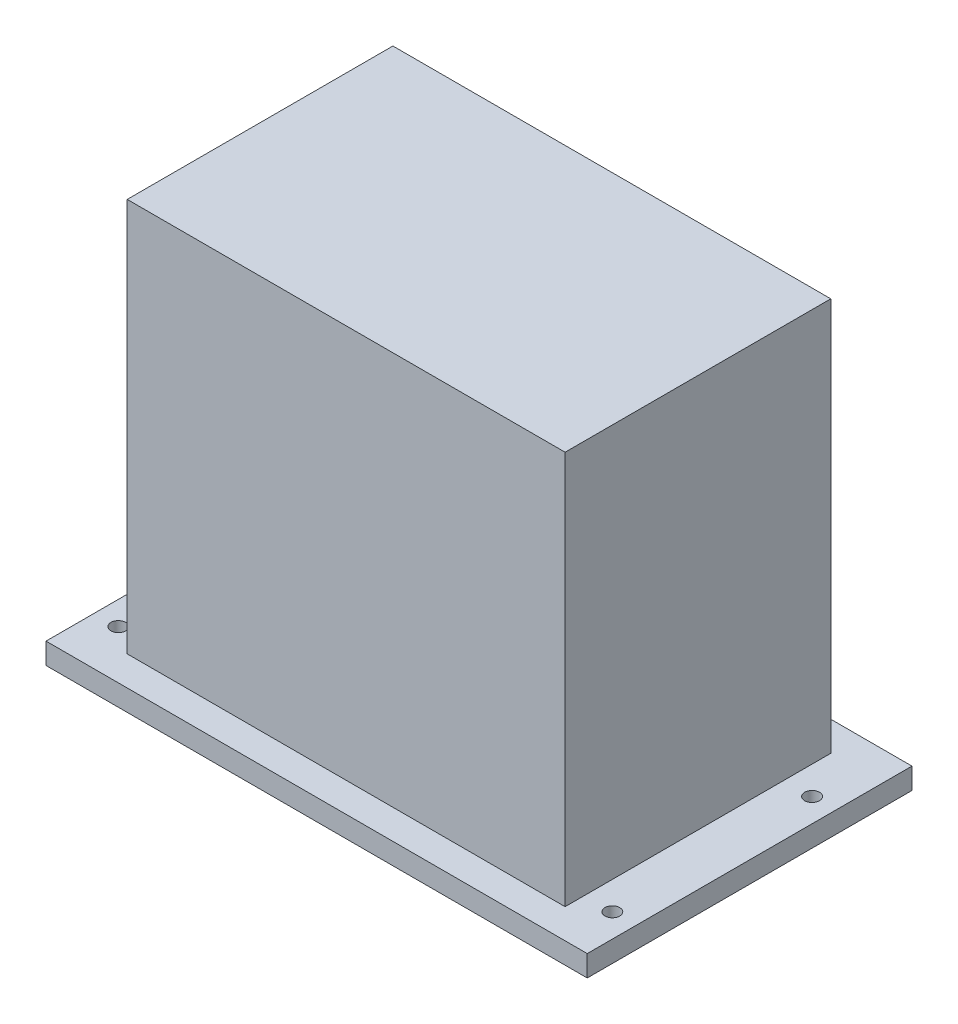
from build123d import *

# Parameters (mm, degrees)
SKETCH1_R           = 1.5
BOSS_EXTRUDE1_DEPTH = 4.3
SKETCH2_W           = 89
SKETCH2_H           = 54
BOSS_EXTRUDE2_DEPTH = 80


with BuildPart() as part:
    # Sketch1 → Boss-Extrude1 (new body)
    with BuildSketch(Plane(origin=(0, 0, 0), x_dir=(1, 0, 0), z_dir=(0, 1, 0))):
        Polygon((-35.5, 27), (-35.5, 33), (-55, 33), (-55, -33), (55, -33), (55, 33), (35.5, 33), (35.5, 27), (15.5, 27), (15.5, 33), (-15.5, 33), (-15.5, 27), align=None)
        with Locations((-50.2, -23.1)):
            Circle(SKETCH1_R, mode=Mode.SUBTRACT)
        with Locations((-42.2, -24.2)):
            Circle(SKETCH1_R, mode=Mode.SUBTRACT)
        with Locations((42.2, -24.2)):
            Circle(SKETCH1_R, mode=Mode.SUBTRACT)
        with Locations((50.2, -23.1)):
            Circle(SKETCH1_R, mode=Mode.SUBTRACT)
        with Locations((-50.2, 17.5)):
            Circle(SKETCH1_R, mode=Mode.SUBTRACT)
        with Locations((-42.2, 24.5)):
            Circle(SKETCH1_R, mode=Mode.SUBTRACT)
        with Locations((50.2, 17.5)):
            Circle(SKETCH1_R, mode=Mode.SUBTRACT)
        with Locations((42.2, 24.5)):
            Circle(SKETCH1_R, mode=Mode.SUBTRACT)
    extrude(amount=BOSS_EXTRUDE1_DEPTH)

    # Sketch2 → Boss-Extrude2 (add)
    with BuildSketch(Plane(origin=(0, 4.3, 0), x_dir=(1, 0, 0), z_dir=(0, 1, 0))):
        Rectangle(SKETCH2_W, SKETCH2_H)
    extrude(amount=BOSS_EXTRUDE2_DEPTH)


solid = part.part
